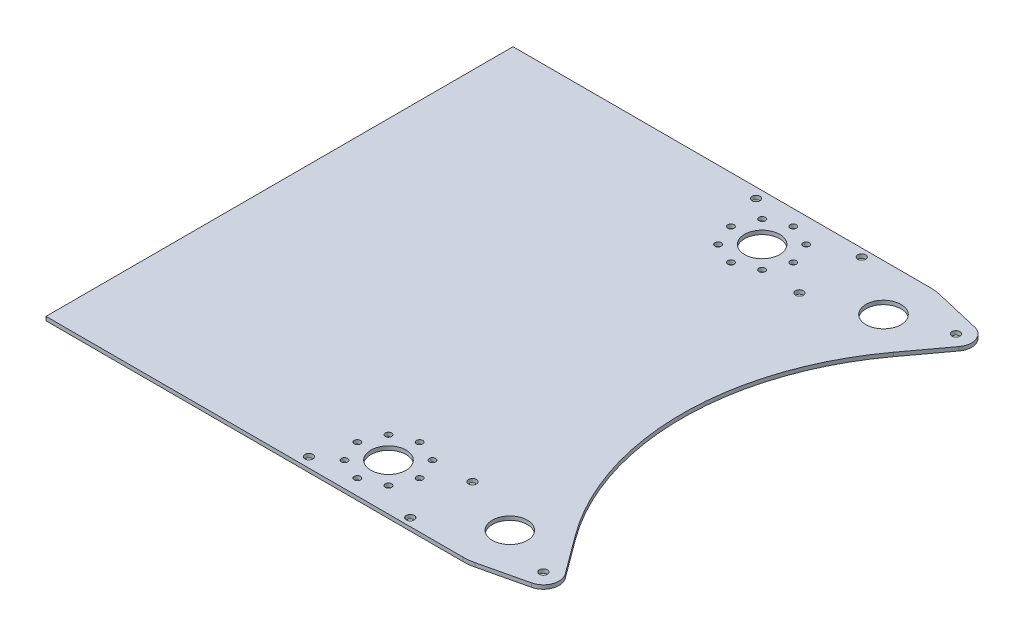
from build123d import *

# Parameters (mm, degrees)
SKETCH1_W           = 431.8
SKETCH1_H           = 381
BOSS_EXTRUDE1_DEPTH = 3.175
SKETCH7_R           = 14.3129
SKETCH7_R_2         = 2.5527
AXLE_HOLES_DEPTH    = 288.946419712
SKETCH10_R          = 3.2385
CUT_EXTRUDE5_DEPTH  = 288.946419712
CUT_EXTRUDE4_START  = -3.175
CUT_EXTRUDE4_DEPTH  = 3.175


# Read off the part's stored shape, not the designer's step: Cut-Extrude4
with BuildPart() as part:
    # Sketch1 → Boss-Extrude1 (new body)
    with BuildSketch(Plane(origin=(0, 0, 0), x_dir=(1, 0, 0), z_dir=(0, 1, 0))):
        Rectangle(SKETCH1_W, SKETCH1_H)
    extrude(amount=BOSS_EXTRUDE1_DEPTH)

    # Sketch7 → Axle Holes (cut, through all)
    with BuildSketch(Plane(origin=(0, 3.175, 0), x_dir=(1, 0, 0), z_dir=(0, 1, 0))):
        with Locations(Location((124.4092, -152.4, 0), (0, 0, 270))):
            Circle(SKETCH7_R)
        with Locations(Location((124.4092, 152.4, 0), (0, 0, 270))):
            Circle(SKETCH7_R)
        with Locations(Location((25.4, 152.4, 0), (0, 0, 270))):
            Circle(SKETCH7_R)
        with Locations(Location((25.4, -152.4, 0), (0, 0, 270))):
            Circle(SKETCH7_R)
        with Locations(Location((0, 152.4, 0), (0, 0, 270))):
            Circle(SKETCH7_R_2)
        with Locations(Location((7.439487758, 170.360512242, 0), (0, 0, 270))):
            Circle(SKETCH7_R_2)
        with Locations(Location((25.4, 177.8, 0), (0, 0, 270))):
            Circle(SKETCH7_R_2)
        with Locations(Location((43.360512242, 170.360512242, 0), (0, 0, 270))):
            Circle(SKETCH7_R_2)
        with Locations(Location((25.4, -127, 0), (0, 0, 270))):
            Circle(SKETCH7_R_2)
        with Locations(Location((43.360512242, -134.439487758, 0), (0, 0, 270))):
            Circle(SKETCH7_R_2)
        with Locations(Location((50.8, -152.4, 0), (0, 0, 270))):
            Circle(SKETCH7_R_2)
        with Locations(Location((43.360512242, -170.360512242, 0), (0, 0, 270))):
            Circle(SKETCH7_R_2)
        with Locations(Location((50.8, 152.4, 0), (0, 0, 270))):
            Circle(SKETCH7_R_2)
        with Locations(Location((43.360512242, 134.439487758, 0), (0, 0, 270))):
            Circle(SKETCH7_R_2)
        with Locations(Location((25.4, 127, 0), (0, 0, 270))):
            Circle(SKETCH7_R_2)
        with Locations(Location((7.439487758, 134.439487758, 0), (0, 0, 270))):
            Circle(SKETCH7_R_2)
        with Locations(Location((25.4, -177.8, 0), (0, 0, 270))):
            Circle(SKETCH7_R_2)
        with Locations(Location((7.439487758, -170.360512242, 0), (0, 0, 270))):
            Circle(SKETCH7_R_2)
        with Locations(Location((0, -152.4, 0), (0, 0, 270))):
            Circle(SKETCH7_R_2)
        with Locations(Location((7.439487758, -134.439487758, 0), (0, 0, 270))):
            Circle(SKETCH7_R_2)
    extrude(amount=-AXLE_HOLES_DEPTH, mode=Mode.SUBTRACT)

    # Sketch10 → Cut-Extrude5 (cut, through all)
    with BuildSketch(Plane(origin=(0, 3.175, 0), x_dir=(1, 0, 0), z_dir=(0, 1, 0))):
        with Locations(Location((-9.525, -182.394929259, 0), (0, 0, 270))):
            Circle(SKETCH10_R)
        with Locations(Location((74.9046, -184.15, 0), (0, 0, 270))):
            Circle(SKETCH10_R)
        with Locations(Location((74.9046, -133.35, 0), (0, 0, 270))):
            Circle(SKETCH10_R)
        with Locations(Location((167.623037844, -168.275, 0), (0, 0, 270))):
            Circle(SKETCH10_R)
        with Locations(Location((167.623037844, 168.275, 0), (0, 0, 90))):
            Circle(SKETCH10_R)
        with Locations(Location((74.9046, 184.15, 0), (0, 0, 90))):
            Circle(SKETCH10_R)
        with Locations(Location((74.9046, 133.35, 0), (0, 0, 90))):
            Circle(SKETCH10_R)
        with Locations(Location((-9.525, 182.394929259, 0), (0, 0, 90))):
            Circle(SKETCH10_R)
    extrude(amount=-CUT_EXTRUDE5_DEPTH, mode=Mode.SUBTRACT)

    # Cut-Extrude4 outline → Cut-Extrude4 (cut)
    with BuildSketch(Plane(origin=(0, 3.175, 0), x_dir=(1, 0, 0), z_dir=(0, 1, 0)).offset(CUT_EXTRUDE4_START)):
        with BuildLine():
            Line((170.541801783, -180.70028669), (133.121928175, -189.490408029))
            ThreePointArc((133.121928175, -189.490408029), (128.794713317, -190.246760402), (124.4092, -190.5))
            Line((124.4092, -190.5), (215.9, -190.5))
            Line((215.9, -190.5), (215.9, 190.5))
            Line((215.9, 190.5), (124.4092, 190.5))
            ThreePointArc((124.4092, 190.5), (128.794713317, 190.246760402), (133.121928175, 189.490408029))
            Line((133.121928175, 189.490408029), (170.541801783, 180.70028669))
            ThreePointArc((170.541801783, 180.70028669), (179.603701854, 172.676206897), (177.891266843, 160.694076212))
            Line((177.891266843, 160.694076212), (155.060629846, 129.770376751))
            ThreePointArc((155.060629846, 129.770376751), (112.346540244, 0), (155.060629846, -129.770376751))
            Line((155.060629846, -129.770376751), (177.891266843, -160.694076212))
            ThreePointArc((177.891266843, -160.694076212), (179.603701854, -172.676206897), (170.541801783, -180.70028669))
        make_face()
    extrude(amount=CUT_EXTRUDE4_DEPTH, mode=Mode.SUBTRACT)


solid = part.part
